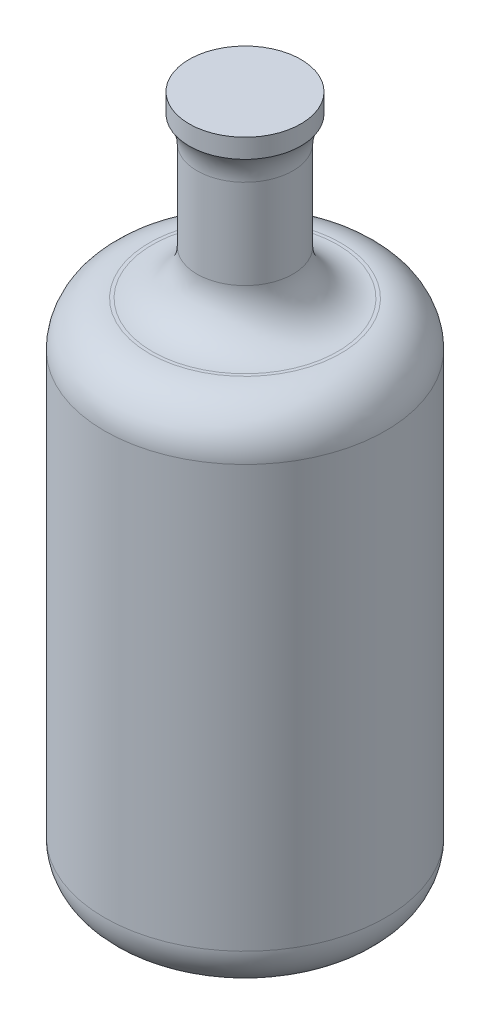
from build123d import *

# Parameters (mm, degrees)
ESQUISSE1_R        = 44
BOSS_EXTRU_1_DEPTH = 160
ESQUISSE2_R        = 15
BOSS_EXTRU_2_DEPTH = 50
ESQUISSE3_R        = 17.5
BOSS_EXTRU_3_DEPTH = 6
CONG_1_R           = 14
CONG_2_R           = 14
CONG_3_R           = 14


with BuildPart() as part:
    # Esquisse1 → Boss.-Extru.1 (new body)
    with BuildSketch(Plane(origin=(0, 0, 0), x_dir=(1, 0, 0), z_dir=(0, 1, 0))):
        with Locations(Location((0, 0, 0), (0, 0, 270))):
            Circle(ESQUISSE1_R)
    extrude(amount=BOSS_EXTRU_1_DEPTH)

    # Esquisse2 → Boss.-Extru.2 (add)
    with BuildSketch(Plane(origin=(0, 160, 0), x_dir=(1, 0, 0), z_dir=(0, 1, 0))):
        with Locations(Location((0, 0, 0), (0, 0, 270))):
            Circle(ESQUISSE2_R)
    extrude(amount=BOSS_EXTRU_2_DEPTH)

    # Esquisse3 → Boss.-Extru.3 (add)
    with BuildSketch(Plane(origin=(0, 210, 0), x_dir=(1, 0, 0), z_dir=(0, 1, 0))):
        with Locations(Location((0, 0, 0), (0, 0, 270))):
            Circle(ESQUISSE3_R)
    extrude(amount=BOSS_EXTRU_3_DEPTH)

    # Congé1
    cong_1_edges = [part.edges().sort_by_distance(p)[0] for p in [
        (0, 160, -44),
        (0, 160, -15),
    ]]
    fillet(cong_1_edges, radius=CONG_1_R)

    # Congé2
    # the kernel refuses this fillet: 14 mm, written as the material it adds along each edge
    with BuildSketch(Plane(origin=(0, 210, 0), x_dir=(0, 0, 1), z_dir=(-1, 0, 0))) as cong_2_piece_1:
        with BuildLine():
            CenterArc((29, -7.984359711), CONG_2_R, 145.228055968, 34.771944032)
            Line((17.5, 0), (17.27, 0.159687194))
            ThreePointArc((17.27, 0.159687194), (16.25, 0.28), (15, 0.28))
            Line((15, 0.28), (14.72, 0))
            Line((14.72, 0), (14.72, -7.984359711))
            Line((14.72, -7.984359711), (15, -7.984359711))
        make_face()
    revolve(axis=Axis((0, 210, 0), (0, 1, 0)))

    # Congé3
    cong_3_edges = [part.edges().sort_by_distance(p)[0] for p in [
        (0, 0, -44),
    ]]
    fillet(cong_3_edges, radius=CONG_3_R)


solid = part.part
